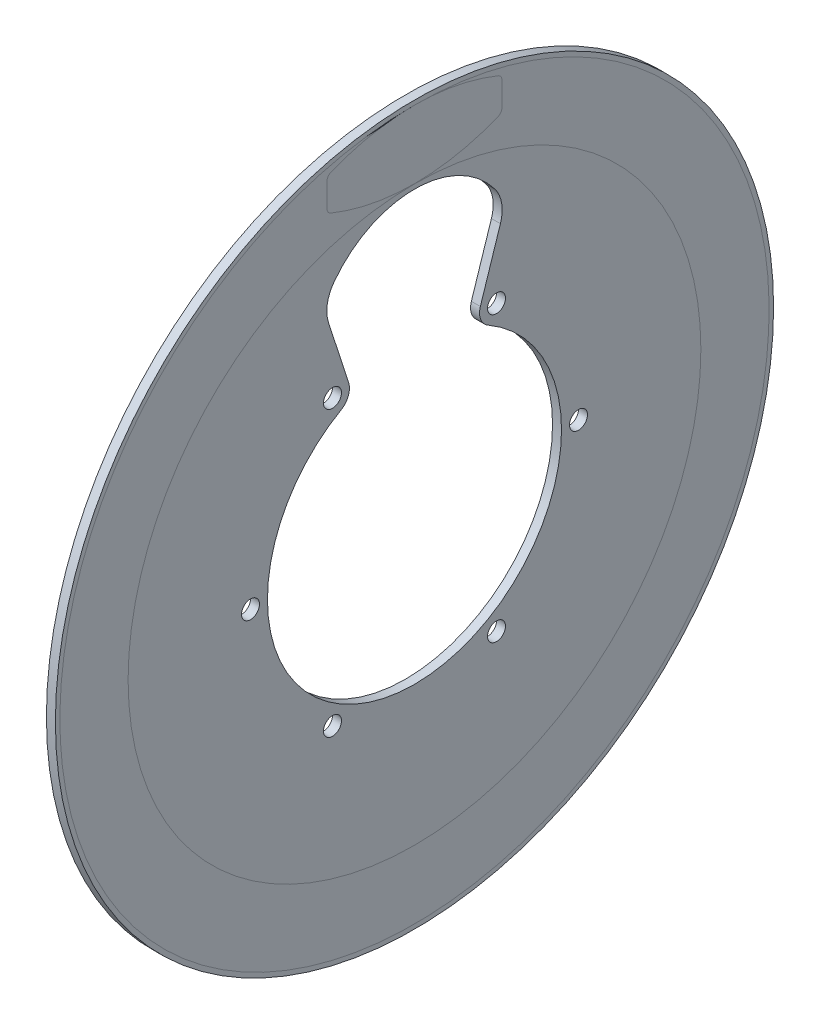
from build123d import *

# Parameters (mm, degrees)
SKETCH1_R           = 127
SKETCH1_R_2         = 3.175
BOSS_EXTRUDE1_DEPTH = 3.175


with BuildPart() as part:
    # Sketch1 → Boss-Extrude1 (new body)
    with BuildSketch(Plane(origin=(0, 0, 0), x_dir=(0, 0, -1), z_dir=(1, 0, 0))):
        Circle(SKETCH1_R)
        with Locations((-29, -50.229473419)):
            Circle(SKETCH1_R_2, mode=Mode.SUBTRACT)
        with Locations((29, -50.229473419)):
            Circle(SKETCH1_R_2, mode=Mode.SUBTRACT)
        with Locations((-58, 0)):
            Circle(SKETCH1_R_2, mode=Mode.SUBTRACT)
        with Locations((-29, 50.229473419)):
            Circle(SKETCH1_R_2, mode=Mode.SUBTRACT)
        with BuildLine():
            Line((30.383459631, 73.903732215), (23.293660902, 52.083575386))
            ThreePointArc((23.293660902, 52.083575386), (23.398517441, 48.079265722), (26, 45.033320997))
            ThreePointArc((26, 45.033320997), (45.033320997, 26), (52, 0))
            ThreePointArc((52, 0), (-26, -45.033320997), (-26, 45.033320997))
            ThreePointArc((-26, 45.033320997), (-23.398517441, 48.079265722), (-23.293660902, 52.083575386))
            Line((-23.293660902, 52.083575386), (-30.383459631, 73.903732215))
            ThreePointArc((-30.383459631, 73.903732215), (-30.834532769, 79.902340114), (-28.474509582, 85.435608068))
            ThreePointArc((-28.474509582, 85.435608068), (0, 99.695), (28.474509582, 85.435608068))
            ThreePointArc((28.474509582, 85.435608068), (30.834532769, 79.902340114), (30.383459631, 73.903732215))
        make_face(mode=Mode.SUBTRACT)
        with Locations((58, 0)):
            Circle(SKETCH1_R_2, mode=Mode.SUBTRACT)
        with Locations((29, 50.229473419)):
            Circle(SKETCH1_R_2, mode=Mode.SUBTRACT)
    extrude(amount=BOSS_EXTRUDE1_DEPTH)


solid = part.part
